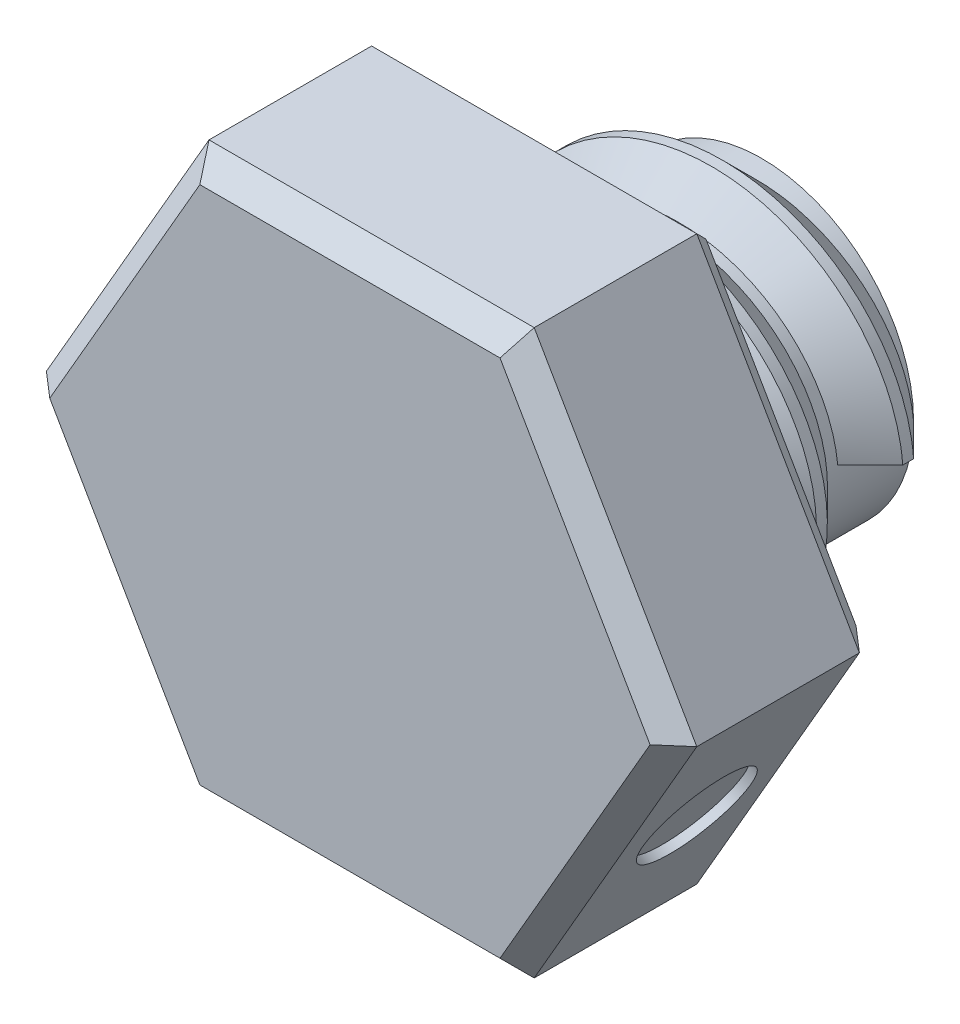
from build123d import *

# Parameters (mm, degrees)
EXTRUDE_1_DEPTH     = 9.5
SKETCH_6_R          = 7
EXTRUDE_2_DEPTH     = 9.5
SWEEP_1_PITCH       = 4
REVOLVE_2_ANGLE     = 45
CHAMFER_1_SIZE      = 1
CUT_EXTRUDE_2_DEPTH = 0.4
SKETCH_13_R         = 2.5
CUT_EXTRUDE_3_DEPTH = 0.4
CUT_EXTRUDE_4_DEPTH = 0.4
SKETCH_14_W         = 5
SKETCH_14_H         = 5
CUT_EXTRUDE_5_DEPTH = 0.4


with BuildPart() as part:
    # 草图1 → 凸台-拉伸1 (new body)
    with BuildSketch(Plane.XY):
        Polygon((15, 0), (7.5, 12.990381057), (-7.5, 12.990381057), (-15, 0), (-7.5, -12.990381057), (7.5, -12.990381057), align=None)
    extrude(amount=EXTRUDE_1_DEPTH)

    # 草图6 → 凸台-拉伸2 (add)
    with BuildSketch(Plane(origin=(0, 0, 0), x_dir=(-1, 0, 0), z_dir=(0, 0, -1))):
        Circle(SKETCH_6_R)
    extrude(amount=EXTRUDE_2_DEPTH)

    # 扫描1: the profile of 草图8 profile screwed along a right-hand helix of 1.5 turns, 12 arcs to a turn; built about Z, then put on its axis
    sweep_1_z = Axis((0, 0, 0), (0, 0, 1))
    sweep_1_corners = [(6.9997, 0, 1.7503), (6.9997, 0, -1.7503), (8.5, 0, -0.25), (8.5, 0, 0.25)]
    with BuildLine(mode=Mode.PRIVATE) as sweep_1_profile:
        Line(sweep_1_corners[0], sweep_1_corners[1])
        Line(sweep_1_corners[1], sweep_1_corners[2])
        Line(sweep_1_corners[2], sweep_1_corners[3])
        Line(sweep_1_corners[3], sweep_1_corners[0])
    sweep_1_cap = Face(sweep_1_profile.wire())
    sweep_1_turn_angles = [0, 15, 30, 45, 60, 75, 90, 105, 120, 135, 150, 165, 180, 195, 210, 225, 240, 255, 270, 285, 300, 315, 330, 345, 360]
    sweep_1_turn_weights = [1, 0.9659258262890683, 1, 0.9659258262890683, 1, 0.9659258262890683, 1, 0.9659258262890683, 1, 0.9659258262890683, 1, 0.9659258262890683, 1, 0.9659258262890683, 1, 0.9659258262890683, 1, 0.9659258262890683, 1, 0.9659258262890683, 1, 0.9659258262890683, 1, 0.9659258262890683, 1]
    sweep_1_turn_rails = [Edge.make_bspline([Vector(p[0], p[1], 0).rotate(sweep_1_z, sweep_1_turn_angles[k]) / sweep_1_turn_weights[k] + Vector(0, 0, p[2] + SWEEP_1_PITCH * sweep_1_turn_angles[k] / 360) for k in range(25)], [0, 0, 0, 1, 1, 2, 2, 3, 3, 4, 4, 5, 5, 6, 6, 7, 7, 8, 8, 9, 9, 10, 10, 11, 11, 12, 12, 12], 2, sweep_1_turn_weights) for p in sweep_1_corners]
    sweep_1_turn_sides = [Face.make_surface_from_curves(sweep_1_turn_rails[p[0]], sweep_1_turn_rails[p[1]]) for p in [(0, 1), (1, 2), (2, 3), (3, 0)]]
    sweep_1_last_angles = [360, 375, 390, 405, 420, 435, 450, 465, 480, 495, 510, 525, 540]
    sweep_1_last_weights = [1, 0.9659258262890683, 1, 0.9659258262890683, 1, 0.9659258262890683, 1, 0.9659258262890683, 1, 0.9659258262890683, 1, 0.965925826289066, 1]
    sweep_1_last_rails = [Edge.make_bspline([Vector(p[0], p[1], 0).rotate(sweep_1_z, sweep_1_last_angles[k]) / sweep_1_last_weights[k] + Vector(0, 0, p[2] + SWEEP_1_PITCH * sweep_1_last_angles[k] / 360) for k in range(13)], [0, 0, 0, 1, 1, 2, 2, 3, 3, 4, 4, 5, 5, 6, 6, 6], 2, sweep_1_last_weights) for p in sweep_1_corners]
    sweep_1_last_sides = [Face.make_surface_from_curves(sweep_1_last_rails[p[0]], sweep_1_last_rails[p[1]]) for p in [(0, 1), (1, 2), (2, 3), (3, 0)]]
    sweep_1 = Plane(origin=(0, 0, -1.75), x_dir=(-1, 0, 0), z_dir=(0, 0, -1)) * Solid(Shell([*sweep_1_turn_sides, *sweep_1_last_sides, sweep_1_cap, sweep_1_cap.rotate(sweep_1_z, 540).moved(Location((0, 0, SWEEP_1_PITCH * 540 / 360)))]))
    add(sweep_1)

    # 草图9 → 旋转2 (revolve)
    with BuildSketch(Plane(origin=(0, 0, 0), x_dir=(1, 0, 0), z_dir=(0, 1, 0))):
        Polygon((7, 3.5), (7, 0), (8.5, 1.5), (8.5, 2), align=None)
    revolve(axis=Axis((0, 0, 0), (0, 0, 1)), revolution_arc=REVOLVE_2_ANGLE)

    # 倒角1
    chamfer_1_edges = [part.edges().sort_by_distance(p)[0] for p in [
        (-11.25, 6.495190528, 9.5),
        (-11.25, -6.495190528, 9.5),
        (0, -12.990381057, 9.5),
        (11.25, -6.495190528, 9.5),
        (11.25, 6.495190528, 9.5),
        (11.25, -6.495190528, 0),
        (0, -12.990381057, 0),
        (-11.25, -6.495190528, 0),
        (-11.25, 6.495190528, 0),
        (0, 12.990381057, 0),
        (11.25, 6.495190528, 0),
        (0, 12.990381057, 9.5),
    ]]
    chamfer(chamfer_1_edges, length=CHAMFER_1_SIZE)

    # 草图11 → 切除-拉伸2 (cut)
    with BuildSketch(Plane(origin=(-11.25, -6.495190528, 0), x_dir=(0, 0, 1), z_dir=(-0.8660254037844389, -0.4999999999999995, 0))):
        Polygon((2.25, 0), (7.25, 2.886751346), (7.25, -2.886751346), align=None)
    extrude(amount=-CUT_EXTRUDE_2_DEPTH, mode=Mode.SUBTRACT)

    # 草图13 → 切除-拉伸3 (cut)
    with BuildSketch(Plane(origin=(11.25, -6.495190528, 0), x_dir=(0, 0, -1), z_dir=(0.8660254037844387, -0.5000000000000001, 0))):
        with Locations(Location((-4.75, 0, 0), (0, 0, 90))):
            Circle(SKETCH_13_R)
    extrude(amount=-CUT_EXTRUDE_3_DEPTH, mode=Mode.SUBTRACT)

    # 草图12 → 切除-拉伸4 (cut)
    with BuildSketch(Plane.XZ.offset(12.990381057)):
        Polygon((-2.5, 6.825735931), (2.075735931, 2.25), (2.5, 2.674264069), (-2.075735931, 7.25), align=None)
        Polygon((2.075735931, 7.25), (-2.5, 2.674264069), (-2.075735931, 2.25), (2.5, 6.825735931), align=None)
    extrude(amount=-CUT_EXTRUDE_4_DEPTH, mode=Mode.SUBTRACT)

    # 草图14 → 切除-拉伸5 (cut)
    with BuildSketch(Plane(origin=(-11.25, 6.495190528, 0), x_dir=(0, 0, 1), z_dir=(-0.8660254037844384, 0.5000000000000006, 0))):
        with Locations((4.75, 0)):
            Rectangle(SKETCH_14_W, SKETCH_14_H)
    extrude(amount=-CUT_EXTRUDE_5_DEPTH, mode=Mode.SUBTRACT)


solid = part.part
